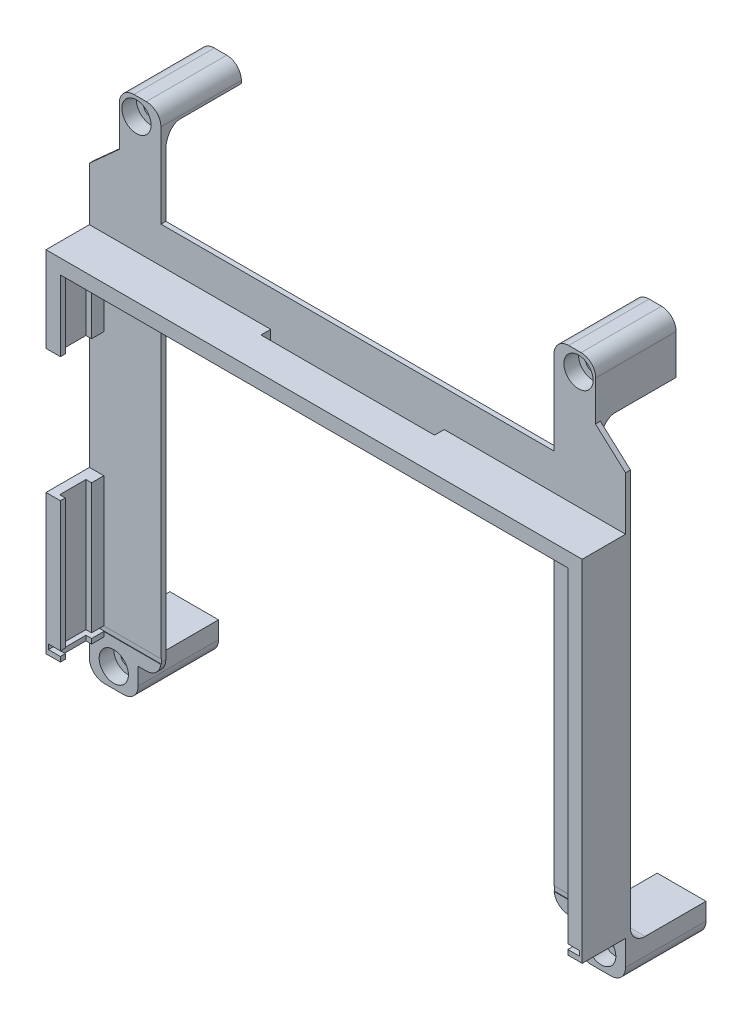
from build123d import *

# Parameters (mm, degrees)
SKETCH1_W             = 6.535180092
SKETCH1_H             = 10
SKETCH1_R             = 1.6
BOSS_EXTRUDE1_DEPTH   = 15.5
BOSS_EXTRUDE1_2_DEPTH = 15.5
BOSS_EXTRUDE1_3_DEPTH = 15.5
BOSS_EXTRUDE1_4_DEPTH = 15.5
SKETCH2_R             = 1.6
BOSS_EXTRUDE2_DEPTH   = 1
SKETCH3_W             = 2.95
SKETCH3_H             = 28.672472045
BOSS_EXTRUDE3_DEPTH   = 2.5
BOSS_EXTRUDE4_DEPTH   = 5.4
SKETCH5_W             = 2.95
SKETCH5_H             = 28.672472045
BOSS_EXTRUDE5_DEPTH   = 1
SKETCH7_W             = 109
SKETCH7_H             = 1
CUT_EXTRUDE1_DEPTH    = 9
FILLET1_R             = 3
FILLET2_R             = 3
SKETCH8_W             = 35.6
SKETCH8_H             = 2
CUT_EXTRUDE2_DEPTH    = 2
SKETCH9_R             = 3
CUT_EXTRUDE3_DEPTH    = 3


with BuildPart() as part:
    # Sketch1 → Boss-Extrude1 (new body)
    with BuildSketch(Plane(origin=(0, 0, 0), x_dir=(0, 1, 0), z_dir=(0, 0, 1))):
        with Locations((-50.739127193, -49.754164457)):
            Rectangle(SKETCH1_W, SKETCH1_H)
        with Locations(Location((-50.006717239, -49.754164457, 0), (0, 0, 270))):
            Circle(SKETCH1_R, mode=Mode.SUBTRACT)
    extrude(amount=BOSS_EXTRUDE1_DEPTH)



with BuildPart() as body_2:
    # Sketch1 → Boss-Extrude1 2 (new body)
    with BuildSketch(Plane(origin=(0, 0, 0), x_dir=(0, 1, 0), z_dir=(0, 0, 1))):
        Polygon((42.477965747, -48.576148962), (50.136732851, -40.077363358), (53.691226628, -40.077363358), (53.691226628, -48.640781304), align=None)
        with Locations(Location((49.993282761, -45.101777457, 0), (0, 0, 270))):
            Circle(SKETCH1_R, mode=Mode.SUBTRACT)
    extrude(amount=BOSS_EXTRUDE1_2_DEPTH)


with BuildPart() as body_3:
    # Sketch1 → Boss-Extrude1 3 (new body)
    with BuildSketch(Plane(origin=(0, 0, 0), x_dir=(0, 1, 0), z_dir=(0, 0, 1))):
        Polygon((53.691226628, 49.132452389), (42.477965747, 49.067820047), (50.136732851, 40.569034443), (53.691226628, 40.569034443), align=None)
        with Locations(Location((49.993282761, 45.593448542, 0), (0, 0, 90))):
            Circle(SKETCH1_R, mode=Mode.SUBTRACT)
    extrude(amount=BOSS_EXTRUDE1_3_DEPTH)


with BuildPart() as body_4:
    # Sketch1 → Boss-Extrude1 4 (new body)
    with BuildSketch(Plane(origin=(0, 0, 0), x_dir=(0, 1, 0), z_dir=(0, 0, 1))):
        with Locations((-50.739127193, 50.245835543)):
            Rectangle(SKETCH1_W, SKETCH1_H)
        with Locations(Location((-50.006717239, 50.245835543, 0), (0, 0, 90))):
            Circle(SKETCH1_R, mode=Mode.SUBTRACT)
    extrude(amount=BOSS_EXTRUDE1_4_DEPTH)


with BuildPart() as part_1:
    add(part.part)

    add(body_2.part)  # Boss-Extrude2 merges body 2

    add(body_3.part)  # Boss-Extrude2 merges body 3

    add(body_4.part)  # Boss-Extrude2 merges body 4
    # Sketch2 → Boss-Extrude2 (add)
    with BuildSketch(Plane.XY.offset(15.5)):
        Polygon((54.754164457, -47.471537147), (54.754164457, -54.006717239), (44.754164457, -54.006717239), (44.754164457, -47.471537147), (40.077363358, -47.471537147), (40.077363358, 20.986771333), (-40.569034443, 20.986771333), (-40.569034443, -47.471537147), (-45.245835543, -47.471537147), (-45.245835543, -54.006717239), (-55.245835543, -54.006717239), (-55.245835543, -47.471537147), (-55.245835543, 36.910584236), (-49.067820047, 42.477965747), (-49.132452389, 53.691226628), (-40.569034443, 53.691226628), (-40.569034443, 33.42328432), (40.077363358, 33.42328432), (40.077363358, 53.691226628), (48.640781304, 53.691226628), (48.576148962, 42.477965747), (54.754164457, 36.910584236), align=None)
        with Locations((49.754164457, -50.006717239)):
            Circle(SKETCH2_R, mode=Mode.SUBTRACT)
        with Locations((45.101777457, 49.993282761)):
            Circle(SKETCH2_R, mode=Mode.SUBTRACT)
        with Locations(Location((-45.593448542, 49.993282761, 0), (0, 0, 180))):
            Circle(SKETCH2_R, mode=Mode.SUBTRACT)
        with Locations(Location((-50.245835543, -50.006717239, 0), (0, 0, 180))):
            Circle(SKETCH2_R, mode=Mode.SUBTRACT)
    extrude(amount=BOSS_EXTRUDE2_DEPTH)

    # Sketch3 → Boss-Extrude3 (add)
    with BuildSketch(Plane.XY.offset(16.5)):
        Polygon((-52.295835543, 8.439904174), (-52.295835543, 22.986771333), (51.804164457, 22.986771333), (51.804164457, -45.813228667), (54.754164457, -45.813228667), (54.754164457, 25.986771333), (-55.245835543, 25.986771333), (-55.245835543, 8.439904174), align=None)
        with Locations((-53.770835543, -31.476992645)):
            Rectangle(SKETCH3_W, SKETCH3_H)
    extrude(amount=BOSS_EXTRUDE3_DEPTH)

    # Sketch4 → Boss-Extrude4 (add)
    with BuildSketch(Plane.XY.offset(19)):
        Polygon((-55.245835543, 25.986771333), (54.754164457, 25.986771333), (54.754164457, -45.813228667), (52.954164457, -45.813228667), (52.954164457, -43.913228667), (52.954164457, 24.086771333), (-53.445835543, 24.086771333), (-53.445835543, 8.439904174), (-55.245835543, 8.439904174), align=None)
        Polygon((-55.245835543, -45.813228667), (-53.445835543, -45.813228667), (-53.445835543, -43.913228667), (-53.445835543, -17.140756622), (-55.245835543, -17.140756622), align=None)
    extrude(amount=BOSS_EXTRUDE4_DEPTH)

    # Sketch5 → Boss-Extrude5 (add)
    with BuildSketch(Plane.XY.offset(24.4)):
        Polygon((-55.245835543, 8.439904174), (-52.295835543, 8.439904174), (-52.295835543, 22.986771333), (51.804164457, 22.986771333), (51.804164457, -45.813228667), (54.754164457, -45.813228667), (54.754164457, 25.986771333), (-55.245835543, 25.986771333), align=None)
        with Locations((-53.770835543, -31.476992645)):
            Rectangle(SKETCH5_W, SKETCH5_H)
    extrude(amount=BOSS_EXTRUDE5_DEPTH)

    # Sketch7 → Cut-Extrude1 (cut)
    with BuildSketch(Plane.XY.offset(25.4)):
        with Locations((-0.245835543, -44.313228667)):
            Rectangle(SKETCH7_W, SKETCH7_H)
    extrude(amount=-CUT_EXTRUDE1_DEPTH, mode=Mode.SUBTRACT)

    # Fillet1
    fillet1_edges = [part_1.edges().sort_by_distance(p)[0] for p in [
        (48.640781304, 53.691226628, 7.75),
        (-49.132452389, 53.691226628, 7.75),
        (-40.569034443, -47.471537147, 16),
        (-55.245835543, -54.006717239, 8.25),
        (-45.245835543, -54.006717239, 8.25),
        (40.077363358, -47.471537147, 16),
        (44.754164457, -54.006717239, 8.25),
        (54.754164457, -54.006717239, 8.25),
        (40.077363358, 53.691226628, 7.75),
        (-40.569034443, 53.691226628, 7.75),
    ]]
    fillet(fillet1_edges, radius=FILLET1_R)

    # Fillet2
    # the kernel refuses this fillet: 3 mm, written as the material it adds along each edge
    with BuildSketch(Plane(origin=(54.147639825, 37.457160078, 15.5), x_dir=(0, 0, -1), z_dir=(-0.7428654483971854, 0.6694407558385198, 0))) as fillet2_piece_1_section:
        with BuildLine():
            CenterArc((FILLET2_R, FILLET2_R), FILLET2_R, 180, 90)
            Line((0, FILLET2_R), (0, 0))
            Line((0, 0), (FILLET2_R, 0))
        make_face()
    fillet2_piece_1 = extrude(amount=26.440545017, mode=Mode.PRIVATE)
    fillet2_piece_1 = split(fillet2_piece_1, bisect_by=Plane(origin=(48.592895704, 45.383408694, 14.829727011), z_dir=(-0.9999833890252455, 0.005763824562264406, 0)), keep=Keep.TOP, mode=Mode.PRIVATE)
    fillet2_piece_1 = split(fillet2_piece_1, bisect_by=Plane(origin=(40.077363358, 45.408013282, 14.829727011), z_dir=(1, 0, 0)), keep=Keep.TOP, mode=Mode.PRIVATE)
    add(fillet2_piece_1)
    with BuildSketch(Plane(origin=(-54.63931091, 37.457160078, 15.5), x_dir=(0, 0, -1), z_dir=(0.7428654483971854, 0.6694407558385198, 0))) as fillet2_piece_2_section:
        with BuildLine():
            CenterArc((FILLET2_R, -FILLET2_R), FILLET2_R, 90, 90)
            Line((0, -FILLET2_R), (0, 0))
            Line((0, 0), (FILLET2_R, 0))
        make_face()
    fillet2_piece_2 = extrude(amount=26.440545017, mode=Mode.PRIVATE)
    fillet2_piece_2 = split(fillet2_piece_2, bisect_by=Plane(origin=(-40.569034443, 45.408013282, 14.829727011), z_dir=(-1, 0, 0)), keep=Keep.TOP, mode=Mode.PRIVATE)
    fillet2_piece_2 = split(fillet2_piece_2, bisect_by=Plane(origin=(-49.084566789, 45.383408694, 14.829727011), z_dir=(0.9999833890252455, 0.005763824562264406, 0)), keep=Keep.TOP, mode=Mode.PRIVATE)
    add(fillet2_piece_2)
    with BuildSketch(Plane(origin=(-45.245835543, -47.471537147, 15.5), x_dir=(0, 0, -1), z_dir=(-1, 0, 0)), Plane(origin=(44.754164457, -47.471537147, 15.5), x_dir=(0, 1, 0), z_dir=(1, 0, 0))) as fillet2_piece_3:
        with BuildLine():
            CenterArc((FILLET2_R, -FILLET2_R), FILLET2_R, 90, 90)
            Line((0, -FILLET2_R), (0, 0))
            Line((0, 0), (FILLET2_R, 0))
        make_face()
    extrude(amount=10)

    # Sketch8 → Cut-Extrude2 (cut)
    with BuildSketch(Plane(origin=(0, 25.986771333, 0), x_dir=(-1, 0, 0), z_dir=(0, 1, 0))):
        with Locations((0.245835543, 17.5)):
            Rectangle(SKETCH8_W, SKETCH8_H)
    extrude(amount=-CUT_EXTRUDE2_DEPTH, mode=Mode.SUBTRACT)

    # Sketch9 → Cut-Extrude3 (cut)
    with BuildSketch(Plane.XY.offset(16.5)):
        with Locations((-45.593448542, 49.993282761)):
            Circle(SKETCH9_R)
        with Locations((-50.245835543, -50.006717239)):
            Circle(SKETCH9_R)
        with Locations(Location((49.754164457, -50.006717239, 0), (0, 0, 64.455545536))):
            Circle(SKETCH9_R)
        with Locations(Location((45.101777457, 49.993282761, 0), (0, 0, 180))):
            Circle(SKETCH9_R)
    extrude(amount=-CUT_EXTRUDE3_DEPTH, mode=Mode.SUBTRACT)


solid = part_1.part
